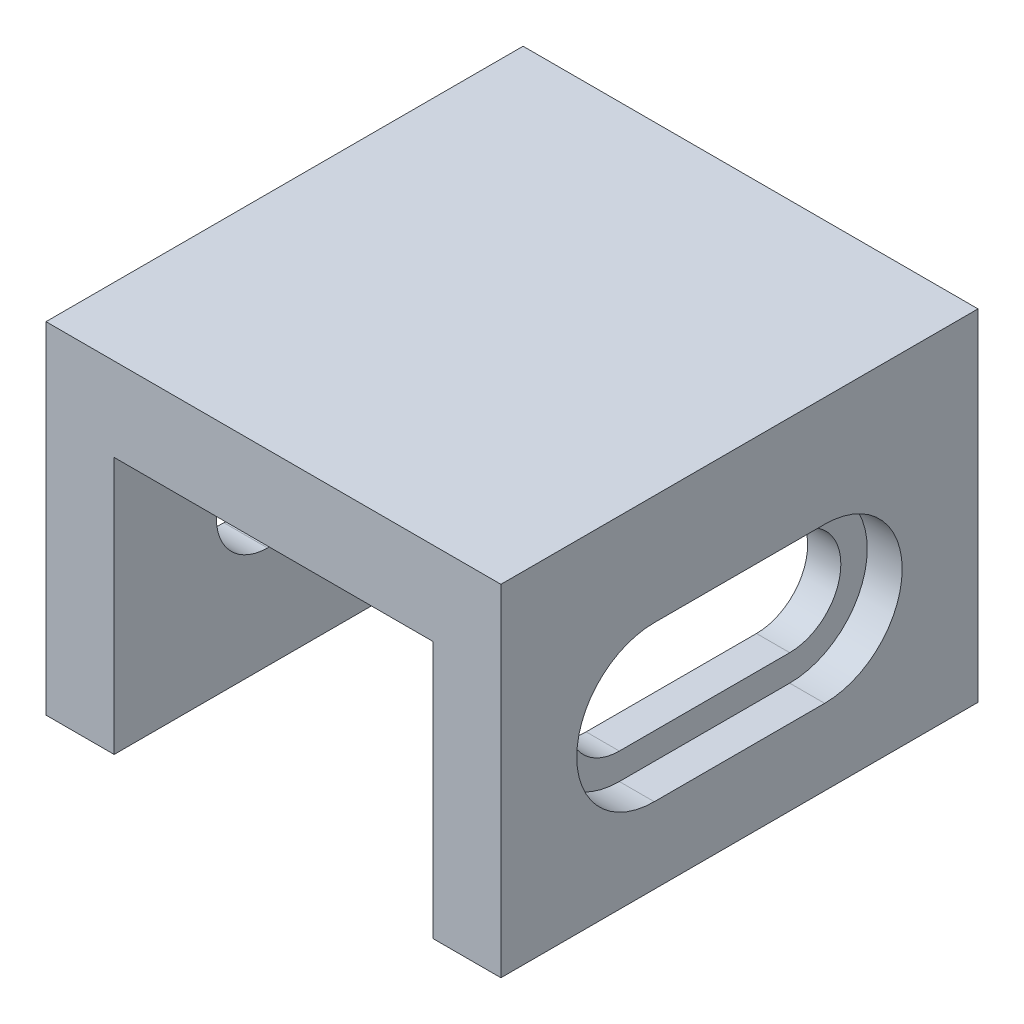
from build123d import *

# Parameters (mm, degrees)
SKETCH1_W           = 26.7
SKETCH1_H           = 28
BOSS_EXTRUDE1_DEPTH = 20
CUT_EXTRUDE1_DEPTH  = 27.5
CUT_EXTRUDE2_DEPTH  = 1.45
CUT_EXTRUDE3_START  = -2.05
CUT_EXTRUDE3_DEPTH  = 2.05
SKETCH5_W           = 18.7
SKETCH5_H           = 28
CUT_EXTRUDE4_DEPTH  = 15.1


with BuildPart() as part:
    # Sketch1 → Boss-Extrude1 (new body)
    with BuildSketch(Plane(origin=(0, 0, 0), x_dir=(1, 0, 0), z_dir=(0, 1, 0))):
        with Locations((13.35, 14)):
            Rectangle(SKETCH1_W, SKETCH1_H)
    extrude(amount=BOSS_EXTRUDE1_DEPTH)

    # Sketch2 → Cut-Extrude1 (cut)
    with BuildSketch(Plane.ZY):
        with BuildLine():
            Line((-19, 12), (-9, 12))
            ThreePointArc((-9, 12), (-6, 9), (-9, 6))
            Line((-9, 6), (-19, 6))
            ThreePointArc((-19, 6), (-22, 9), (-19, 12))
        make_face()
    extrude(amount=-CUT_EXTRUDE1_DEPTH, mode=Mode.SUBTRACT)

    # Sketch3 → Cut-Extrude2 (cut)
    with BuildSketch(Plane.ZY):
        with BuildLine():
            Line((-19, 13.55), (-9, 13.55))
            ThreePointArc((-9, 13.55), (-4.45, 9), (-9, 4.45))
            Line((-9, 4.45), (-19, 4.45))
            ThreePointArc((-19, 4.45), (-23.55, 9), (-19, 13.55))
        make_face()
    extrude(amount=-CUT_EXTRUDE2_DEPTH, mode=Mode.SUBTRACT)

    # Sketch4 → Cut-Extrude3 (cut)
    with BuildSketch(Plane(origin=(26.7, 0, 0), x_dir=(0, 0, -1), z_dir=(1, 0, 0)).offset(CUT_EXTRUDE3_START)):
        with BuildLine():
            Line((9, 13.55), (19, 13.55))
            ThreePointArc((19, 13.55), (23.55, 9), (19, 4.45))
            Line((19, 4.45), (9, 4.45))
            ThreePointArc((9, 4.45), (4.45, 9), (9, 13.55))
        make_face()
    extrude(amount=CUT_EXTRUDE3_DEPTH, mode=Mode.SUBTRACT)

    # Sketch5 → Cut-Extrude4 (cut)
    with BuildSketch(Plane(origin=(0, 0, 0), x_dir=(1, 0, 0), z_dir=(0, 1, 0))):
        with Locations((13.35, 14)):
            Rectangle(SKETCH5_W, SKETCH5_H)
    extrude(amount=CUT_EXTRUDE4_DEPTH, mode=Mode.SUBTRACT)


solid = part.part
